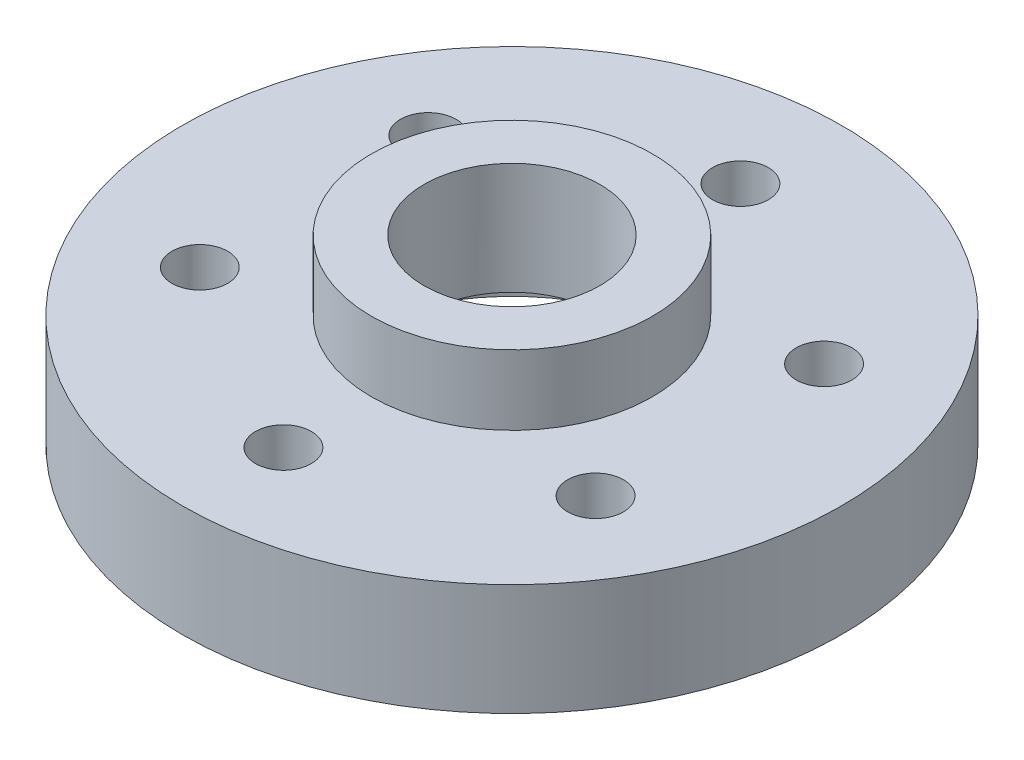
from build123d import *

# Parameters (mm, degrees)
SKETCH1_R           = 37.5
SKETCH1_R_2         = 10
BOSS_EXTRUDE1_DEPTH = 12.7
BOSS_EXTRUDE2_START = 7.9375
SKETCH2_R           = 16
SKETCH2_R_2         = 10
BOSS_EXTRUDE2_DEPTH = 7.9375
SKETCH3_R           = 20.6375
CUT_EXTRUDE1_DEPTH  = 7.9375
SKETCH4_R           = 3.175
CUT_EXTRUDE2_DEPTH  = 57.906997867
CIRPATTERN1_COUNT   = 6


with BuildPart() as part:
    # Sketch1 → Boss-Extrude1 (new body)
    with BuildSketch(Plane(origin=(0, 0, 0), x_dir=(1, 0, 0), z_dir=(0, 1, 0))):
        Circle(SKETCH1_R)
        Circle(SKETCH1_R_2, mode=Mode.SUBTRACT)
    extrude(amount=-BOSS_EXTRUDE1_DEPTH)

    # Sketch2 → Boss-Extrude2 (add)
    with BuildSketch(Plane(origin=(0, 0, 0), x_dir=(1, 0, 0), z_dir=(0, 1, 0)).offset(BOSS_EXTRUDE2_START)):
        Circle(SKETCH2_R)
        Circle(SKETCH2_R_2, mode=Mode.SUBTRACT)
    extrude(amount=-BOSS_EXTRUDE2_DEPTH)

    # Sketch3 → Cut-Extrude1 (cut)
    with BuildSketch(Plane.XZ.offset(12.7)):
        Circle(SKETCH3_R)
    extrude(amount=-CUT_EXTRUDE1_DEPTH, mode=Mode.SUBTRACT)

    # Sketch4 → Cut-Extrude2 (cut, through all)
    with BuildSketch(Plane.XZ.offset(12.7)):
        with Locations((0, 26)):
            Circle(SKETCH4_R)
    cut_extrude2 = extrude(amount=-CUT_EXTRUDE2_DEPTH, mode=Mode.SUBTRACT)

    # CirPattern1: Cut-Extrude2 ×6 about axis
    cirpattern1_axis = Axis((0, -12.7, 0), (0, -1, 0))
    for i in range(1, CIRPATTERN1_COUNT):
        add(cut_extrude2.rotate(cirpattern1_axis, i * 360 / CIRPATTERN1_COUNT), mode=Mode.SUBTRACT)


solid = part.part
